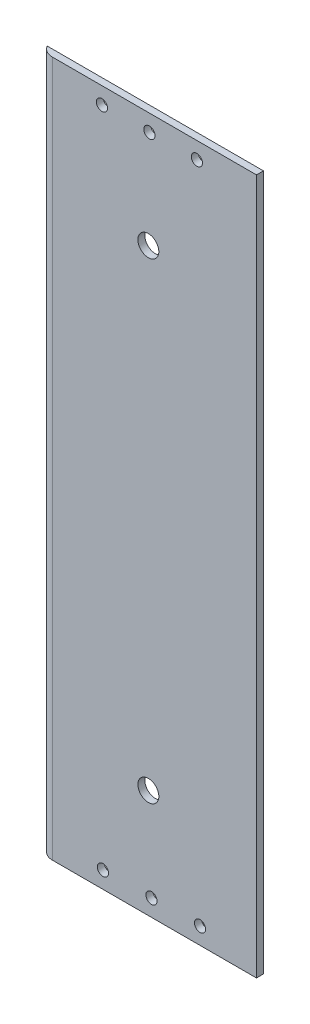
from build123d import *

# Parameters (mm, degrees)
SKETCH1_W          = 155
SKETCH1_H          = 498.5268
BASE_FLANGE1_DEPTH = 5
CUT_EXTRUDE2_REACH = 473.277
SKETCH6_R          = 7.5
CUT_EXTRUDE3_REACH = 473.277
SKETCH7_R          = 4
FILLET1_R          = 10


# Sheet-metal steps are written as plain solids
with BuildPart() as part:
    # Sketch1 → Base-Flange1 (new body)
    with BuildSketch(Plane.XY):
        with Locations((-77.5, -195.767163373)):
            Rectangle(SKETCH1_W, SKETCH1_H)
    extrude(amount=BASE_FLANGE1_DEPTH)

    # Sketch6 → Cut-Extrude2 (cut, up to next)
    with BuildSketch(Plane.XY.offset(5), mode=Mode.PRIVATE) as cut_extrude2_sk1:
        with Locations((-77.5, -367.367664241)):
            Circle(SKETCH6_R)
    cut_extrude2_tool1 = extrude(cut_extrude2_sk1.sketch, amount=-CUT_EXTRUDE2_REACH, mode=Mode.PRIVATE) & part.part
    # Sketch6 → Cut-Extrude2 (cut, up to next)
    with BuildSketch(Plane.XY.offset(5), mode=Mode.PRIVATE) as cut_extrude2_sk2:
        with Locations((-77.5, -29.166662504)):
            Circle(SKETCH6_R)
    cut_extrude2_tool2 = extrude(cut_extrude2_sk2.sketch, amount=-CUT_EXTRUDE2_REACH, mode=Mode.PRIVATE) & part.part
    add(cut_extrude2_tool1.solids().sort_by_distance((-77.5, -367.367664, 5))[0], mode=Mode.SUBTRACT)
    add(cut_extrude2_tool2.solids().sort_by_distance((-77.5, -29.166663, 5))[0], mode=Mode.SUBTRACT)

    # Sketch7 → Cut-Extrude3 (cut, up to next)
    with BuildSketch(Plane.XY.offset(5), mode=Mode.PRIVATE) as cut_extrude3_sk1:
        with Locations((-110.070394878, -433.005563373)):
            Circle(SKETCH7_R)
    cut_extrude3_tool1 = extrude(cut_extrude3_sk1.sketch, amount=-CUT_EXTRUDE3_REACH, mode=Mode.PRIVATE) & part.part
    # Sketch7 → Cut-Extrude3 (cut, up to next)
    with BuildSketch(Plane.XY.offset(5), mode=Mode.PRIVATE) as cut_extrude3_sk2:
        with Locations((-75.272394878, -433.005563373)):
            Circle(SKETCH7_R)
    cut_extrude3_tool2 = extrude(cut_extrude3_sk2.sketch, amount=-CUT_EXTRUDE3_REACH, mode=Mode.PRIVATE) & part.part
    # Sketch7 → Cut-Extrude3 (cut, up to next)
    with BuildSketch(Plane.XY.offset(5), mode=Mode.PRIVATE) as cut_extrude3_sk3:
        with Locations((-40.474394878, -433.005563373)):
            Circle(SKETCH7_R)
    cut_extrude3_tool3 = extrude(cut_extrude3_sk3.sketch, amount=-CUT_EXTRUDE3_REACH, mode=Mode.PRIVATE) & part.part
    # Sketch7 → Cut-Extrude3 (cut, up to next)
    with BuildSketch(Plane.XY.offset(5), mode=Mode.PRIVATE) as cut_extrude3_sk4:
        with Locations((-42.712394878, 41.471236627)):
            Circle(SKETCH7_R)
    cut_extrude3_tool4 = extrude(cut_extrude3_sk4.sketch, amount=-CUT_EXTRUDE3_REACH, mode=Mode.PRIVATE) & part.part
    # Sketch7 → Cut-Extrude3 (cut, up to next)
    with BuildSketch(Plane.XY.offset(5), mode=Mode.PRIVATE) as cut_extrude3_sk5:
        with Locations((-76.748394878, 41.471236627)):
            Circle(SKETCH7_R)
    cut_extrude3_tool5 = extrude(cut_extrude3_sk5.sketch, amount=-CUT_EXTRUDE3_REACH, mode=Mode.PRIVATE) & part.part
    # Sketch7 → Cut-Extrude3 (cut, up to next)
    with BuildSketch(Plane.XY.offset(5), mode=Mode.PRIVATE) as cut_extrude3_sk6:
        with Locations((-110.784394878, 41.471236627)):
            Circle(SKETCH7_R)
    cut_extrude3_tool6 = extrude(cut_extrude3_sk6.sketch, amount=-CUT_EXTRUDE3_REACH, mode=Mode.PRIVATE) & part.part
    add(cut_extrude3_tool1.solids().sort_by_distance((-110.070395, -433.005563, 5))[0], mode=Mode.SUBTRACT)
    add(cut_extrude3_tool2.solids().sort_by_distance((-75.272395, -433.005563, 5))[0], mode=Mode.SUBTRACT)
    add(cut_extrude3_tool3.solids().sort_by_distance((-40.474395, -433.005563, 5))[0], mode=Mode.SUBTRACT)
    add(cut_extrude3_tool4.solids().sort_by_distance((-42.712395, 41.471237, 5))[0], mode=Mode.SUBTRACT)
    add(cut_extrude3_tool5.solids().sort_by_distance((-76.748395, 41.471237, 5))[0], mode=Mode.SUBTRACT)
    add(cut_extrude3_tool6.solids().sort_by_distance((-110.784395, 41.471237, 5))[0], mode=Mode.SUBTRACT)

    # Fillet1
    # the kernel refuses this fillet: 10 mm, written as the material it takes off along each edge
    with BuildSketch(Plane(origin=(-155, 75.146871722, 5), x_dir=(0, 0, -1), z_dir=(0, -1, 0))) as fillet1_piece_1:
        with BuildLine():
            CenterArc((10, 8.660254038), FILLET1_R, 180, 60)
            Line((0, 8.660254038), (-0.2, 8.660254038))
            Line((-0.2, 8.660254038), (-0.2, 0))
            Line((-0.2, 0), (0, -0.2))
            ThreePointArc((0, -0.2), (2.5, -0.2), (4.9, -0.173205081))
            Line((4.9, -0.173205081), (5, 0))
        make_face()
    extrude(amount=541.828070189, mode=Mode.SUBTRACT)


solid = part.part
